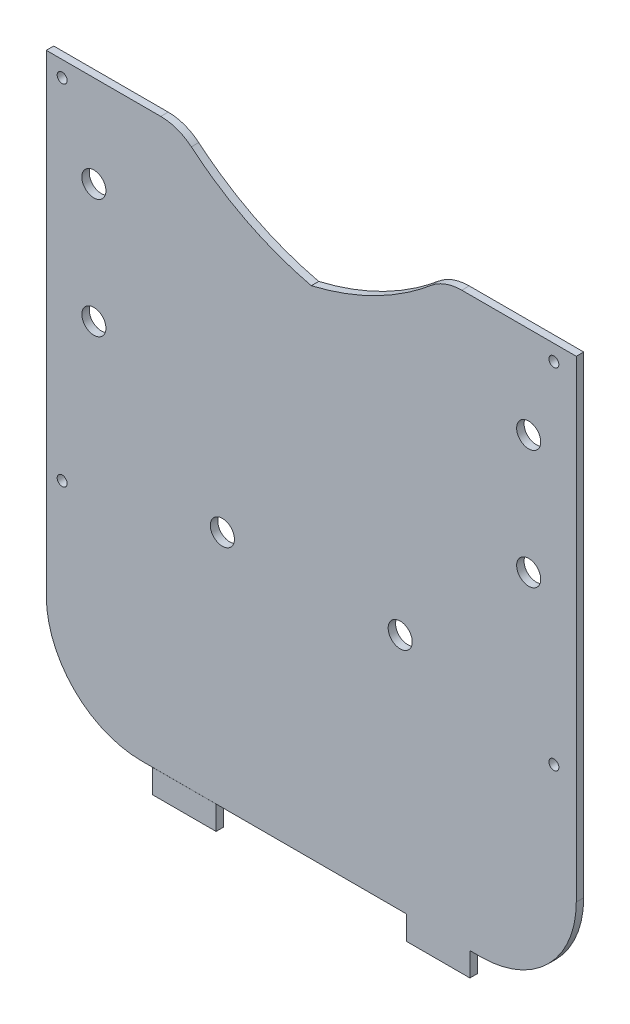
from build123d import *

# Parameters (mm, degrees)
BOSS_EXTRUDE1_DEPTH = 3.96875
SKETCH2_R           = 6.434666667
CUT_EXTRUDE1_DEPTH  = 458.934661801
SCALE1_SCALE        = 0.75
SKETCH3_R           = 2
CUT_EXTRUDE2_DEPTH  = 408.924502354
BOSS_EXTRUDE2_START = -2.9765625
BOSS_EXTRUDE2_DEPTH = 2.9765625
BOSS_EXTRUDE3_DEPTH = 2.9765625
FILLET1_R           = 38.1


# Read off the part's stored shape, not the designer's step: Boss-Extrude2
with BuildPart() as part:
    # Sketch1 → Boss-Extrude1 (new body)
    with BuildSketch(Plane.XY):
        with BuildLine():
            ThreePointArc((125.256263701, 77.943736299), (215.569553449, 113.908167327), (254, 203.2))
            Line((254, 203.2), (254, 304.814964765))
            Line((254, 304.814964765), (254, 381.014964765))
            Line((254, 381.014964765), (192.892022849, 381.014964765))
            ThreePointArc((192.892022849, 381.014964765), (184.21229846, 379.485917501), (176.577590515, 375.082869059))
            add(Edge.make_bspline(
                [(112.556263701, 342.914964765), (136.377690637, 348.603107697), (157.869028788, 359.404778612), (176.577590515, 375.082869059)],
                knots=[0, 0, 0, 0, 0.891694809, 0.891694809, 0.891694809, 0.891694809], degree=3))
            Line((112.556263701, 342.914964765), (112.556263701, 304.814964765))
            Line((112.556263701, 304.814964765), (112.556263701, 77.943736299))
            Line((112.556263701, 77.943736299), (125.256263701, 77.943736299))
        make_face()
    boss_extrude1 = extrude(amount=BOSS_EXTRUDE1_DEPTH)

    # Mirror1: Boss-Extrude1 across plane
    add(boss_extrude1.mirror(Plane(origin=(112.556263701, 0, 3.96875), x_dir=(0, 0, 1), z_dir=(-1, 0, 0))))

    # Sketch2 → Cut-Extrude1 (cut, through all)
    with BuildSketch(Plane.XY.offset(3.96875)):
        with Locations((228.6, 331.931765933)):
            Circle(SKETCH2_R)
        with Locations((228.6, 268.431765933)):
            Circle(SKETCH2_R)
        with Locations((160.02, 205.192231498)):
            Circle(SKETCH2_R)
        with Locations(Location((65.092527401, 205.192231498, 0), (0, 0, 180))):
            Circle(SKETCH2_R)
        with Locations(Location((-3.487472599, 268.431765933, 0), (0, 0, 180))):
            Circle(SKETCH2_R)
        with Locations(Location((-3.487472599, 331.931765933, 0), (0, 0, 180))):
            Circle(SKETCH2_R)
    extrude(amount=-CUT_EXTRUDE1_DEPTH, mode=Mode.SUBTRACT)


with BuildPart() as part_1:
    # Scale1: scaled about (112.556263701, 234.433953078, 1.984375)
    add(part.part.scale(SCALE1_SCALE).moved(Location((28.139065925, 58.60848827, 0.49609375))))

    # Sketch3 → Cut-Extrude2 (cut, through all)
    with BuildSketch(Plane.XY.offset(3.47265625)):
        with Locations((12.823461476, 338.01970885)):
            Circle(SKETCH3_R)
        with Locations((209.673461476, 338.01970885)):
            Circle(SKETCH3_R)
        with Locations((209.673461476, 198.31970885)):
            Circle(SKETCH3_R)
        with Locations((12.823461476, 198.31970885)):
            Circle(SKETCH3_R)
    extrude(amount=-CUT_EXTRUDE2_DEPTH, mode=Mode.SUBTRACT)


with BuildPart() as boss_extrude2_tool:
    # Boss-Extrude2 outline → Boss-Extrude2 (new body)
    with BuildSketch(Plane(origin=(0, 0, 0.49609375), x_dir=(-1, 0, 0), z_dir=(0, 0, -1)).offset(BOSS_EXTRUDE2_START)):
        with BuildLine():
            ThreePointArc((-6.473461476, 211.008485276), (-34.365192323, 144.958018347), (-100.415659252, 117.066287501))
            Line((-100.415659252, 117.066287501), (-6.473461476, 117.066287501))
            Line((-6.473461476, 117.066287501), (-6.473461476, 211.008485276))
        make_face()
        with BuildLine():
            Line((-218.639065925, 211.008485276), (-218.639065925, 117.01064714))
            Line((-218.639065925, 117.01064714), (-124.58709381, 117.064843544))
            ThreePointArc((-124.58709381, 117.064843544), (-190.708509448, 144.919215083), (-218.639065925, 211.008485276))
        make_face()
    extrude(amount=BOSS_EXTRUDE2_DEPTH)


with BuildPart() as part_2:
    add(part_1.part)


with BuildPart() as part_3:
    # Boss-Extrude2: joined with boss_extrude2_tool
    add(part_2.part.fuse(boss_extrude2_tool.part, tol=0.00001))

    # Sketch5 → Boss-Extrude3 (add)
    with BuildSketch(Plane(origin=(0, 0, 0.49609375), x_dir=(-1, 0, 0), z_dir=(0, 0, -1))):
        Polygon((-150.656260143, 107.524821477), (-150.656260143, 117.049821477), (-176.056260143, 117.035185009), (-176.056260143, 107.524821477), align=None)
        Polygon((-49.056267259, 117.035185009), (-74.456267259, 117.049821477), (-74.456267259, 107.524821477), (-49.056267259, 107.524821477), align=None)
    extrude(amount=-BOSS_EXTRUDE3_DEPTH)


with BuildPart() as boss_extrude3_piece_1:
    # of the separate pieces the step leaves, piece 1, a body of its own (boss_extrude3_pieces)
    add(part_3.part.solids().sort_by_distance((122.081263701, 117.066290494, 0.49609375))[0])

    # Fillet1
    fillet1_edges = [boss_extrude3_piece_1.edges().sort_by_distance(p)[0] for p in [
        (218.639065925, 117.01064714, 1.984375),
        (6.473461476, 117.066287501, 1.984375),
    ]]
    fillet(fillet1_edges, radius=FILLET1_R)


with BuildPart() as boss_extrude3_piece_2:
    # of the separate pieces the step leaves, piece 2, a body of its own (boss_extrude3_pieces)
    add(part_3.part.solids().sort_by_distance((49.056267259, 117.035185009, 0.49609375))[0])


solid = Compound([boss_extrude3_piece_1.part, boss_extrude3_piece_2.part])
